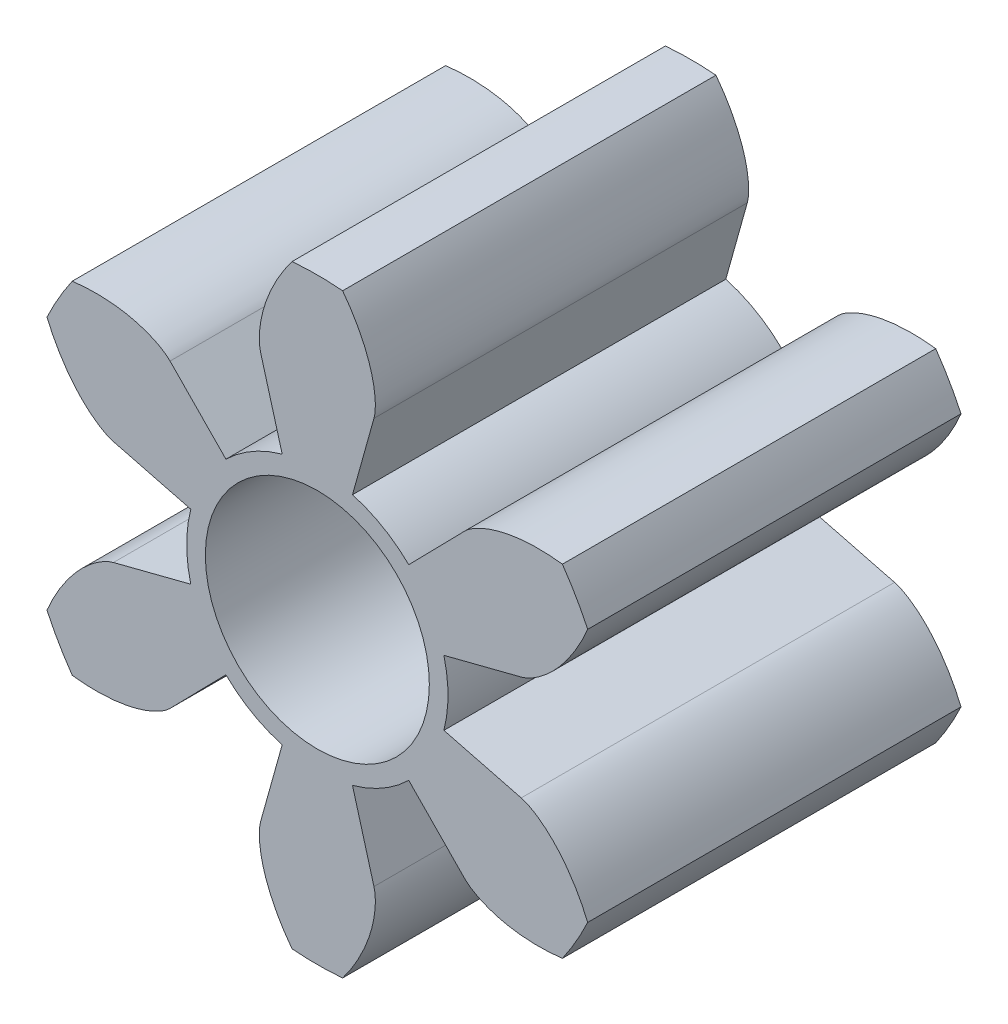
from build123d import *

# Parameters (mm, degrees)
SKETCH_1_R               = 4
SKETCH_1_R_2             = 1.5
EXTRUDE_1_DEPTH          = 5
CUT_EXTRUDE_1_DEPTH      = 8.549834435
PATTERN_CIRCULAR_1_COUNT = 6
PATTERN_CIRCULAR_1_ANGLE = 300


with BuildPart() as part:
    # 草图1 → 凸台-拉伸1 (new body)
    with BuildSketch(Plane.XY):
        Circle(SKETCH_1_R)
        Circle(SKETCH_1_R_2, mode=Mode.SUBTRACT)
    extrude(amount=EXTRUDE_1_DEPTH)

    # 草图1<3> → 切除-拉伸1 (cut, through all)
    with BuildSketch(Plane.XY):
        with BuildLine():
            Line((2.730540893, 0.700961074), (1.695038873, 0.435135863))
            ThreePointArc((1.695038873, 0.435135863), (1.736205349, 0.219296571), (1.75, 0))
            ThreePointArc((1.75, 0), (1.736205349, -0.219296571), (1.695038873, -0.435135863))
            Line((1.695038873, -0.435135863), (2.730540893, -0.700961074))
            add(Edge.make_bspline(
                [(2.730540893, -0.700961074), (2.751355068, -0.706304311), (2.808329953, -0.725541446), (2.910522768, -0.778982289), (3.06267796, -0.887491262), (3.235956594, -1.057334282), (3.408810129, -1.2831446), (3.52264255, -1.482702951), (3.589508983, -1.625182096), (3.620975996, -1.699568426)],
                knots=[0, 0, 0, 0, 0, 0.005604068, 0.015718248, 0.029959916, 0.048733667, 0.068727063, 0.089838728, 0.089838728, 0.089838728, 0.089838728, 0.089838728], degree=4))
            ThreePointArc((3.620975996, -1.699568426), (3.90409426, -0.870659525), (4, 0))
            ThreePointArc((4, 0), (3.90409426, 0.870659525), (3.620975996, 1.699568426))
            add(Edge.make_bspline(
                [(2.730540893, 0.700961074), (2.751355068, 0.706304311), (2.808329953, 0.725541446), (2.910522768, 0.778982289), (3.06267796, 0.887491262), (3.235956594, 1.057334282), (3.408810129, 1.2831446), (3.52264255, 1.482702951), (3.589508983, 1.625182096), (3.620975996, 1.699568426)],
                knots=[0, 0, 0, 0, 0, 0.005604068, 0.015718248, 0.029959916, 0.048733667, 0.068727063, 0.089838728, 0.089838728, 0.089838728, 0.089838728, 0.089838728], degree=4))
        make_face()
    cut_extrude_1 = extrude(amount=CUT_EXTRUDE_1_DEPTH, mode=Mode.SUBTRACT)

    # 阵列(圆周)1: 切除-拉伸1 ×6 about axis
    pattern_circular_1_axis = Axis((0, 0, 5), (0, 0, 1))
    for i in range(1, PATTERN_CIRCULAR_1_COUNT):
        add(cut_extrude_1.rotate(pattern_circular_1_axis, i * PATTERN_CIRCULAR_1_ANGLE / (PATTERN_CIRCULAR_1_COUNT - 1)), mode=Mode.SUBTRACT)


solid = part.part
